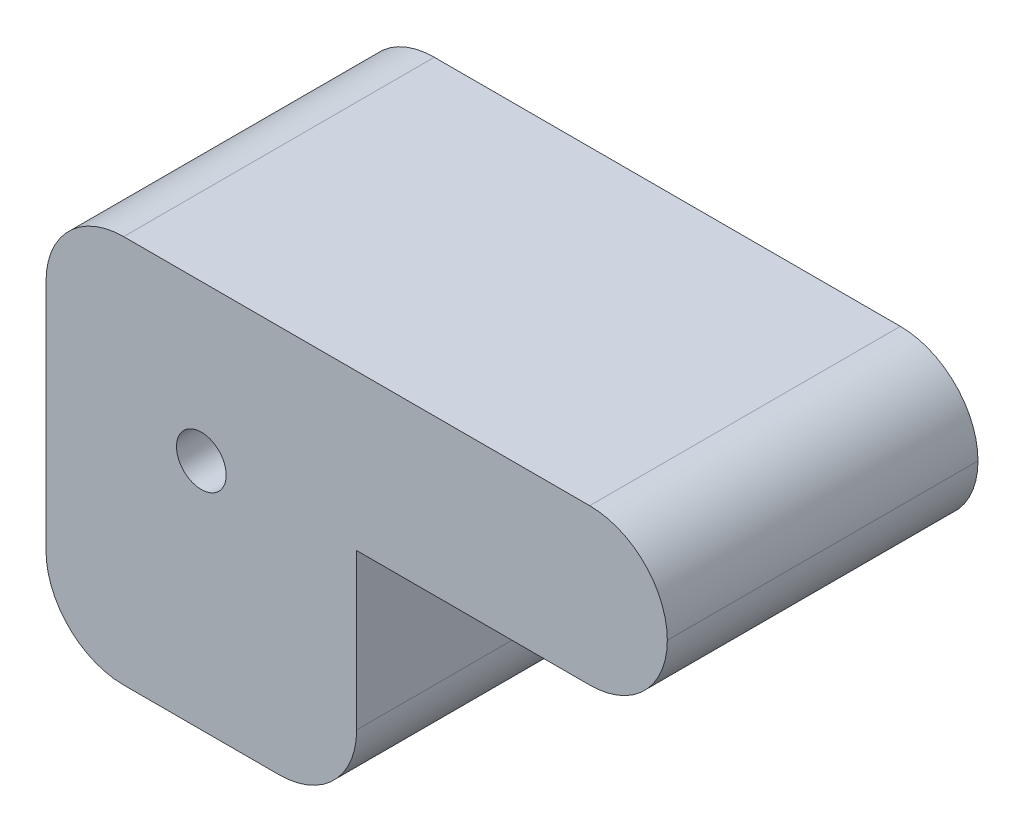
from build123d import *

# Parameters (mm, degrees)
SKETCH_1_W          = 40
SKETCH_1_H          = 10
EXTRUDE_1_DEPTH     = 20
SKETCH_2_W          = 20
SKETCH_2_H          = 25
EXTRUDE_2_DEPTH     = 20
FILLET_1_R          = 5
SKETCH_3_R          = 1.6
CUT_EXTRUDE_1_DEPTH = 48.16990566


with BuildPart() as part:
    # 草图1 → 凸台-拉伸1 (new body)
    with BuildSketch(Plane.XY):
        with Locations((-20, 5)):
            Rectangle(SKETCH_1_W, SKETCH_1_H)
    extrude(amount=EXTRUDE_1_DEPTH)

    # 草图2 → 凸台-拉伸2 (add)
    with BuildSketch(Plane.XY.offset(20)):
        with Locations((-30, -2.5)):
            Rectangle(SKETCH_2_W, SKETCH_2_H)
    extrude(amount=-EXTRUDE_2_DEPTH)

    # 圆角1
    fillet_1_edges = [part.edges().sort_by_distance(p)[0] for p in [
        (0, 10, 10),
        (0, 0, 10),
        (-20, -15, 10),
        (-40, -15, 10),
        (-40, 10, 10),
    ]]
    fillet(fillet_1_edges, radius=FILLET_1_R - 0.0001)  # a hair under: the kernel refuses the full size

    # 草图3 → 切除-拉伸1 (cut, through all)
    with BuildSketch(Plane.XY.offset(20)):
        with Locations((-30, 0)):
            Circle(SKETCH_3_R)
    extrude(amount=-CUT_EXTRUDE_1_DEPTH, mode=Mode.SUBTRACT)


solid = part.part
